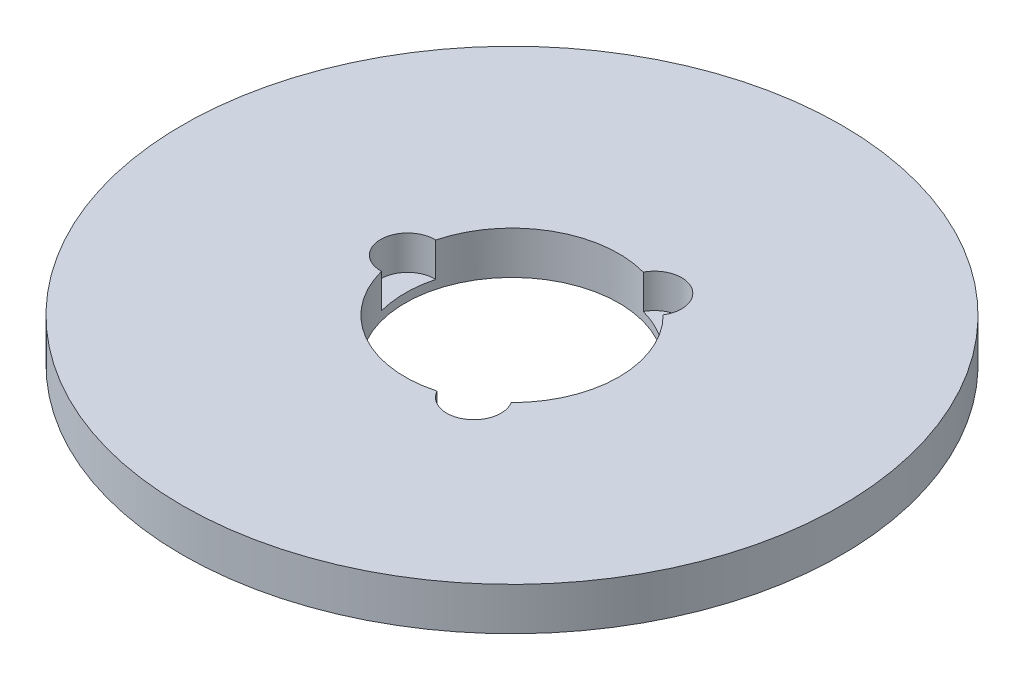
from build123d import *

# Parameters (mm, degrees)
SKETCH1_R           = 92.5
BOSS_EXTRUDE1_DEPTH = 12
SKETCH2_R           = 30
CUT_EXTRUDE1_DEPTH  = 132.363998112
SKETCH3_R           = 7.614419071
CUT_EXTRUDE2_DEPTH  = 9.582717966
CIRPATTERN1_COUNT   = 3


with BuildPart() as part:
    # Sketch1 → Boss-Extrude1 (new body)
    with BuildSketch(Plane(origin=(0, 0, 0), x_dir=(1, 0, 0), z_dir=(0, 1, 0))):
        Circle(SKETCH1_R)
    extrude(amount=BOSS_EXTRUDE1_DEPTH)

    # Sketch2 → Cut-Extrude1 (cut, through all)
    with BuildSketch(Plane(origin=(0, 0, 0), x_dir=(1, 0, 0), z_dir=(0, 1, 0))):
        Circle(SKETCH2_R)
    extrude(amount=CUT_EXTRUDE1_DEPTH, mode=Mode.SUBTRACT)

    # Sketch3 → Cut-Extrude2 (cut)
    with BuildSketch(Plane(origin=(0, 12, 0), x_dir=(1, 0, 0), z_dir=(0, 1, 0))):
        with Locations((-29.272599173, 0)):
            Circle(SKETCH3_R)
    cut_extrude2 = extrude(amount=-CUT_EXTRUDE2_DEPTH, mode=Mode.SUBTRACT)

    # CirPattern1: Cut-Extrude2 ×3 about axis
    cirpattern1_axis = Axis((0, 0, 0), (0, 1, 0))
    for i in range(1, CIRPATTERN1_COUNT):
        add(cut_extrude2.rotate(cirpattern1_axis, i * 360 / CIRPATTERN1_COUNT), mode=Mode.SUBTRACT)


solid = part.part
